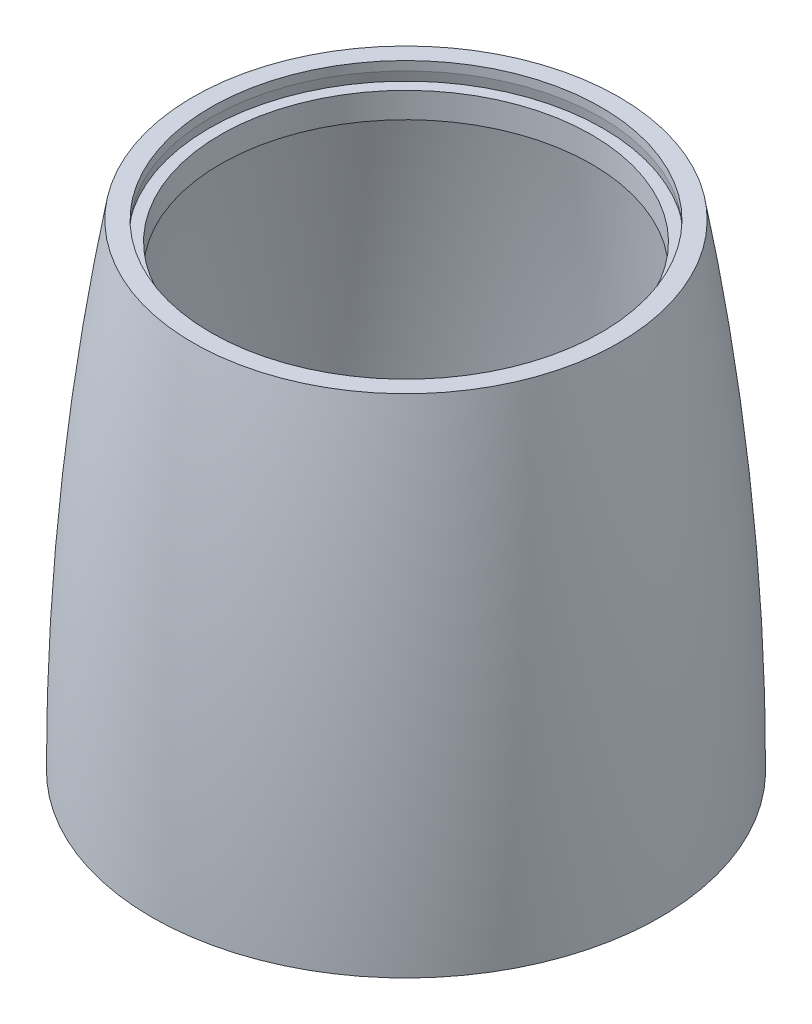
from build123d import *

# Parameters (mm, degrees)
SKETCH2_R          = 30.7
CUT_EXTRUDE1_DEPTH = 3


with BuildPart() as part:
    # Sketch1 → Revolve1 (revolve)
    with BuildSketch(Plane.XY):
        with BuildLine():
            ThreePointArc((31.626449106, 68), (35.654521568, 34.105993056), (37, 0))
            Line((37, 0), (40, 0))
            ThreePointArc((40, 0), (38.371960017, 37.640569868), (33.5, 75))
            Line((33.5, 75), (30.454270378, 75))
            ThreePointArc((30.454270378, 75), (30.715312674, 73.500454239), (30.971081404, 72))
            Line((30.971081404, 72), (29.2, 72))
            Line((29.2, 72), (29.2, 68))
            Line((29.2, 68), (31.626449106, 68))
        make_face()
    revolve(axis=Axis((0, 0, 0), (0, 1, 0)))

    # Sketch2 → Cut-Extrude1 (cut)
    with BuildSketch(Plane(origin=(0, 75, 0), x_dir=(1, 0, 0), z_dir=(0, 1, 0))):
        Circle(SKETCH2_R)
    extrude(amount=-CUT_EXTRUDE1_DEPTH, mode=Mode.SUBTRACT)


solid = part.part
